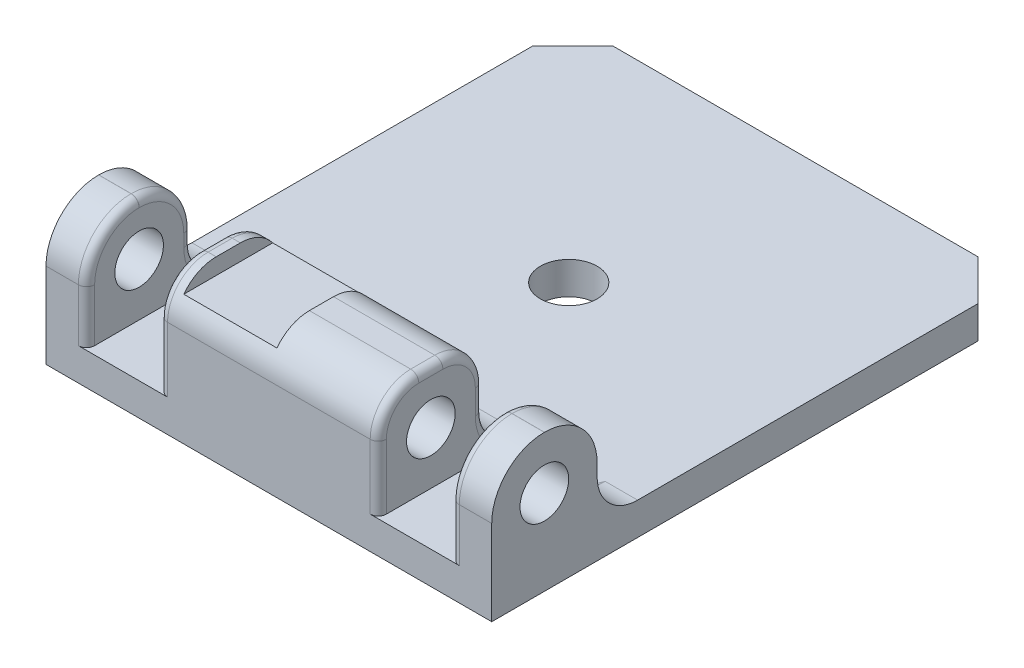
from build123d import *

# Parameters (mm, degrees)
CROQUIS1_W              = 55
CROQUIS1_H              = 65
SALIENTE_EXTRUIR1_DEPTH = 4
CROQUIS5_R              = 3.5
CORTAR_EXTRUIR5_DEPTH   = 72
CHAFL_N1_SIZE           = 5
CROQUIS6_R              = 3
SALIENTE_EXTRUIR2_DEPTH = 55
REDONDEO1_R             = 5
CROQUIS7_W              = 45
CROQUIS7_H              = 13
CROQUIS7_H_2            = 7.525704533
CORTAR_EXTRUIR7_DEPTH   = 20
REDONDEO2_R             = 1
CROQUIS8_W              = 13.499994095
CROQUIS8_H              = 12.974747115
SALIENTE_EXTRUIR3_DEPTH = 13
REDONDEO3_R             = 5
REDONDEO4_R             = 5
REDONDEO5_R             = 1
CROQUIS10_R             = 3
CORTAR_EXTRUIR8_DEPTH   = 26.999988191
CROQUIS11_W             = 11.5
CROQUIS11_H             = 5.447296535
CROQUIS11_H_2           = 2.974747115
CORTAR_EXTRUIR9_DEPTH   = 2


with BuildPart() as part:
    # Croquis1 → Saliente-Extruir1 (new body)
    with BuildSketch(Plane(origin=(0, 0, 0), x_dir=(1, 0, 0), z_dir=(0, 1, 0))):
        Rectangle(CROQUIS1_W, CROQUIS1_H)
    extrude(amount=SALIENTE_EXTRUIR1_DEPTH)

    # Croquis5 → Cortar-Extruir5 (cut)
    with BuildSketch(Plane.XZ):
        with Locations(Location((0, -4.5, 0), (0, 0, 270))):
            Circle(CROQUIS5_R)
    extrude(amount=-CORTAR_EXTRUIR5_DEPTH, mode=Mode.SUBTRACT)

    # Chaflán1
    chafl_n1_edges = [part.edges().sort_by_distance(p)[0] for p in [
        (-27.5, 2, -32.5),
        (27.5, 2, -32.5),
    ]]
    chamfer(chafl_n1_edges, length=CHAFL_N1_SIZE)

    # Croquis6 → Saliente-Extruir2 (add)
    with BuildSketch(Plane.ZY.offset(27.5)):
        with BuildLine():
            Line((32.5, 0), (19.5, 0))
            Line((19.5, 0), (19.5, 10.51))
            ThreePointArc((19.5, 10.51), (21.40087699, 15.09912301), (25.99, 17))
            Line((25.99, 17), (26.01, 17))
            ThreePointArc((26.01, 17), (30.59912301, 15.09912301), (32.5, 10.51))
            Line((32.5, 10.51), (32.5, 0))
        make_face()
        with Locations((26.01, 10.51)):
            Circle(CROQUIS6_R, mode=Mode.SUBTRACT)
    extrude(amount=-SALIENTE_EXTRUIR2_DEPTH)

    # Redondeo1
    redondeo1_edges = [part.edges().sort_by_distance(p)[0] for p in [
        (0, 4, 19.5),
    ]]
    fillet(redondeo1_edges, radius=REDONDEO1_R)

    # Croquis7 → Cortar-Extruir7 (cut)
    with BuildSketch(Plane(origin=(0, 4, 0), x_dir=(1, 0, 0), z_dir=(0, 1, 0))):
        with Locations((0, -26)):
            Rectangle(CROQUIS7_W, CROQUIS7_H)
        with Locations((0, -15.737147734)):
            Rectangle(CROQUIS7_W, CROQUIS7_H_2)
    extrude(amount=CORTAR_EXTRUIR7_DEPTH, mode=Mode.SUBTRACT)

    # Redondeo2
    # the kernel refuses this fillet: 1 mm, written as the material it takes off along each edge
    with BuildSketch(Plane(origin=(22.5, 9, 14.5), x_dir=(0, 0, 1), z_dir=(0, 1, 0))) as redondeo2_piece_1_section:
        with BuildLine():
            CenterArc((5 + REDONDEO2_R, REDONDEO2_R), REDONDEO2_R, 180, 90)
            Line((5 + REDONDEO2_R, 0), (5, 0))
            Line((5, 0), (5, REDONDEO2_R))
        make_face()
    redondeo2_piece_1 = revolve(axis=Axis((22.5, 9, 14.5), (1, 0, 0)), revolution_arc=138.720976341, mode=Mode.PRIVATE)
    redondeo2_piece_1 = split(redondeo2_piece_1, bisect_by=Plane(origin=(22.5, 4, 14.5), z_dir=(0, 1, 0)), keep=Keep.TOP, mode=Mode.PRIVATE)
    add(redondeo2_piece_1, mode=Mode.SUBTRACT)
    with BuildSketch(Plane(origin=(-22.5, 9, 14.5), x_dir=(0, 0, 1), z_dir=(0, 1, 0))) as redondeo2_piece_2_section:
        with BuildLine():
            CenterArc((5 + REDONDEO2_R, -REDONDEO2_R), REDONDEO2_R, 90, 90)
            Line((5 + REDONDEO2_R, 0), (5, 0))
            Line((5, 0), (5, -REDONDEO2_R))
        make_face()
    redondeo2_piece_2 = revolve(axis=Axis((-22.5, 9, 14.5), (1, 0, 0)), revolution_arc=138.720976341, mode=Mode.PRIVATE)
    redondeo2_piece_2 = split(redondeo2_piece_2, bisect_by=Plane(origin=(-22.5, 4, 14.5), z_dir=(0, 1, 0)), keep=Keep.TOP, mode=Mode.PRIVATE)
    add(redondeo2_piece_2, mode=Mode.SUBTRACT)
    with BuildSketch(Plane(origin=(-22.5, 4, 32.5), x_dir=(-1, 0, 0), z_dir=(0, 1, 0))) as redondeo2_piece_3:
        with BuildLine():
            CenterArc((REDONDEO2_R, -REDONDEO2_R), REDONDEO2_R, 90, 90)
            Line((0, -REDONDEO2_R), (0, 0))
            Line((0, 0), (REDONDEO2_R, 0))
        make_face()
    extrude(amount=6.51, mode=Mode.SUBTRACT)
    with BuildSketch(Plane(origin=(-22.5, 17, 25.99), x_dir=(-1, 0, 0), z_dir=(0, 0, 1))) as redondeo2_piece_4:
        with BuildLine():
            CenterArc((REDONDEO2_R, REDONDEO2_R), REDONDEO2_R, 180, 90)
            Line((0, REDONDEO2_R), (0, 0))
            Line((0, 0), (REDONDEO2_R, 0))
        make_face()
    extrude(amount=0.02, mode=Mode.SUBTRACT)
    with BuildSketch(Plane(origin=(-22.5, 10.51, 26.01), x_dir=(0, 0, 1), z_dir=(0, -1, 0))) as redondeo2_piece_5:
        with BuildLine():
            CenterArc((6.49 - REDONDEO2_R, REDONDEO2_R), REDONDEO2_R, 270, 90)
            Line((6.49 - REDONDEO2_R, 0), (6.49, 0))
            Line((6.49, 0), (6.49, REDONDEO2_R))
        make_face()
    revolve(axis=Axis((-22.5, 10.51, 26.01), (-1, 0, 0)), revolution_arc=90, mode=Mode.SUBTRACT)
    with BuildSketch(Plane(origin=(-22.5, 9, 19.5), x_dir=(-1, 0, 0), z_dir=(0, 1, 0))) as redondeo2_piece_6:
        with BuildLine():
            CenterArc((REDONDEO2_R, REDONDEO2_R), REDONDEO2_R, 180, 90)
            Line((0, REDONDEO2_R), (0, 0))
            Line((0, 0), (REDONDEO2_R, 0))
        make_face()
    extrude(amount=1.51, mode=Mode.SUBTRACT)
    with BuildSketch(Plane(origin=(-22.5, 10.51, 25.99), x_dir=(0, 1, 0), z_dir=(0, 0, 1))) as redondeo2_piece_7:
        with BuildLine():
            CenterArc((6.49 - REDONDEO2_R, REDONDEO2_R), REDONDEO2_R, 270, 90)
            Line((6.49 - REDONDEO2_R, 0), (6.49, 0))
            Line((6.49, 0), (6.49, REDONDEO2_R))
        make_face()
    revolve(axis=Axis((-22.5, 10.51, 25.99), (-1, 0, 0)), revolution_arc=90, mode=Mode.SUBTRACT)
    with BuildSketch(Plane(origin=(22.5, 17, 26.01), x_dir=(0, -1, 0), z_dir=(0, 0, -1))) as redondeo2_piece_8:
        with BuildLine():
            CenterArc((REDONDEO2_R, -REDONDEO2_R), REDONDEO2_R, 90, 90)
            Line((0, -REDONDEO2_R), (0, 0))
            Line((0, 0), (REDONDEO2_R, 0))
        make_face()
    extrude(amount=0.02, mode=Mode.SUBTRACT)
    with BuildSketch(Plane(origin=(22.5, 10.51, 26.01), x_dir=(0, 0, 1), z_dir=(0, -1, 0))) as redondeo2_piece_9:
        with BuildLine():
            CenterArc((6.49 - REDONDEO2_R, -REDONDEO2_R), REDONDEO2_R, 0, 90)
            Line((6.49 - REDONDEO2_R, 0), (6.49, 0))
            Line((6.49, 0), (6.49, -REDONDEO2_R))
        make_face()
    revolve(axis=Axis((22.5, 10.51, 26.01), (-1, 0, 0)), revolution_arc=90, mode=Mode.SUBTRACT)
    with BuildSketch(Plane(origin=(22.5, 4, 32.5), x_dir=(1, 0, 0), z_dir=(0, 1, 0))) as redondeo2_piece_10:
        with BuildLine():
            CenterArc((REDONDEO2_R, REDONDEO2_R), REDONDEO2_R, 180, 90)
            Line((0, REDONDEO2_R), (0, 0))
            Line((0, 0), (REDONDEO2_R, 0))
        make_face()
    extrude(amount=6.51, mode=Mode.SUBTRACT)
    with BuildSketch(Plane(origin=(22.5, 10.51, 19.5), x_dir=(0, 0, 1), z_dir=(0, -1, 0))) as redondeo2_piece_11:
        with BuildLine():
            CenterArc((REDONDEO2_R, -REDONDEO2_R), REDONDEO2_R, 90, 90)
            Line((0, -REDONDEO2_R), (0, 0))
            Line((0, 0), (REDONDEO2_R, 0))
        make_face()
    extrude(amount=1.51, mode=Mode.SUBTRACT)
    with BuildSketch(Plane(origin=(22.5, 10.51, 25.99), x_dir=(0, 1, 0), z_dir=(0, 0, 1))) as redondeo2_piece_12:
        with BuildLine():
            CenterArc((6.49 - REDONDEO2_R, -REDONDEO2_R), REDONDEO2_R, 0, 90)
            Line((6.49, -REDONDEO2_R), (6.49, 0))
            Line((6.49, 0), (6.49 - REDONDEO2_R, 0))
        make_face()
    revolve(axis=Axis((22.5, 10.51, 25.99), (-1, 0, 0)), revolution_arc=90, mode=Mode.SUBTRACT)

    # Croquis8 → Saliente-Extruir3 (add)
    with BuildSketch(Plane(origin=(0, 4, 0), x_dir=(1, 0, 0), z_dir=(0, 1, 0))):
        with Locations((-6.749997048, -26.012626443)):
            Rectangle(CROQUIS8_W, CROQUIS8_H)
        with Locations((6.749997048, -26.012626443)):
            Rectangle(CROQUIS8_W, CROQUIS8_H)
    extrude(amount=SALIENTE_EXTRUIR3_DEPTH)

    # Redondeo3
    redondeo3_edges = [part.edges().sort_by_distance(p)[0] for p in [
        (0, 17, 19.525252885),
        (0, 17, 32.5),
    ]]
    fillet(redondeo3_edges, radius=REDONDEO3_R)

    # Redondeo4
    redondeo4_edges = [part.edges().sort_by_distance(p)[0] for p in [
        (0, 4, 19.525252885),
    ]]
    fillet(redondeo4_edges, radius=REDONDEO4_R)

    # Redondeo5
    # the kernel refuses this fillet: 1 mm, written as the material it takes off along each edge
    with BuildSketch(Plane(origin=(-13.499994095, 9, 19.525252885), x_dir=(0, 0, 1), z_dir=(0, 1, 0))) as redondeo5_piece_1:
        with BuildLine():
            CenterArc((REDONDEO5_R, REDONDEO5_R), REDONDEO5_R, 180, 90)
            Line((0, REDONDEO5_R), (0, 0))
            Line((0, 0), (REDONDEO5_R, 0))
        make_face()
    extrude(amount=3, mode=Mode.SUBTRACT)
    with BuildSketch(Plane(origin=(13.499994095, 9, 19.525252885), x_dir=(0, 0, 1), z_dir=(0, 1, 0))) as redondeo5_piece_2:
        with BuildLine():
            CenterArc((REDONDEO5_R, -REDONDEO5_R), REDONDEO5_R, 90, 90)
            Line((0, -REDONDEO5_R), (0, 0))
            Line((0, 0), (REDONDEO5_R, 0))
        make_face()
    extrude(amount=3, mode=Mode.SUBTRACT)
    with BuildSketch(Plane(origin=(13.499994095, 17, 27.5), x_dir=(0, -1, 0), z_dir=(0, 0, -1)), Plane(origin=(-13.499994095, 17, 24.525252885), x_dir=(0, -1, 0), z_dir=(0, 0, 1))) as redondeo5_piece_3:
        with BuildLine():
            CenterArc((REDONDEO5_R, REDONDEO5_R), REDONDEO5_R, 180, 90)
            Line((0, REDONDEO5_R), (0, 0))
            Line((0, 0), (REDONDEO5_R, 0))
        make_face()
    extrude(amount=2.974747115, mode=Mode.SUBTRACT)
    with BuildSketch(Plane(origin=(13.499994095, 4, 32.5), x_dir=(0, 0, -1), z_dir=(0, 1, 0))) as redondeo5_piece_4:
        with BuildLine():
            CenterArc((REDONDEO5_R, REDONDEO5_R), REDONDEO5_R, 180, 90)
            Line((0, REDONDEO5_R), (0, 0))
            Line((0, 0), (REDONDEO5_R, 0))
        make_face()
    extrude(amount=8, mode=Mode.SUBTRACT)
    with BuildSketch(Plane(origin=(13.499994095, 12, 27.5), x_dir=(0, 0, 1), z_dir=(0, -1, 0))) as redondeo5_piece_5:
        with BuildLine():
            CenterArc((5 - REDONDEO5_R, REDONDEO5_R), REDONDEO5_R, 270, 90)
            Line((5, REDONDEO5_R), (5, 0))
            Line((5, 0), (5 - REDONDEO5_R, 0))
        make_face()
    revolve(axis=Axis((13.499994095, 12, 27.5), (-1, 0, 0)), revolution_arc=90, mode=Mode.SUBTRACT)
    with BuildSketch(Plane(origin=(13.499994095, 12, 24.525252885), x_dir=(0, 0, -1), z_dir=(0, -1, 0))) as redondeo5_piece_6:
        with BuildLine():
            CenterArc((5 - REDONDEO5_R, -REDONDEO5_R), REDONDEO5_R, 0, 90)
            Line((5, -REDONDEO5_R), (5, 0))
            Line((5, 0), (5 - REDONDEO5_R, 0))
        make_face()
    revolve(axis=Axis((13.499994095, 12, 24.525252885), (1, 0, 0)), revolution_arc=90, mode=Mode.SUBTRACT)
    with BuildSketch(Plane(origin=(-13.499994095, 4, 32.5), x_dir=(0, 0, -1), z_dir=(0, 1, 0))) as redondeo5_piece_7:
        with BuildLine():
            CenterArc((REDONDEO5_R, -REDONDEO5_R), REDONDEO5_R, 90, 90)
            Line((0, -REDONDEO5_R), (0, 0))
            Line((0, 0), (REDONDEO5_R, 0))
        make_face()
    extrude(amount=8, mode=Mode.SUBTRACT)
    with BuildSketch(Plane(origin=(-13.499994095, 12, 27.5), x_dir=(0, 0, 1), z_dir=(0, -1, 0))) as redondeo5_piece_8:
        with BuildLine():
            CenterArc((5 - REDONDEO5_R, -REDONDEO5_R), REDONDEO5_R, 0, 90)
            Line((5, -REDONDEO5_R), (5, 0))
            Line((5, 0), (5 - REDONDEO5_R, 0))
        make_face()
    revolve(axis=Axis((-13.499994095, 12, 27.5), (-1, 0, 0)), revolution_arc=90, mode=Mode.SUBTRACT)
    with BuildSketch(Plane(origin=(-13.499994095, 12, 24.525252885), x_dir=(0, 0, -1), z_dir=(0, -1, 0))) as redondeo5_piece_9:
        with BuildLine():
            CenterArc((5 - REDONDEO5_R, REDONDEO5_R), REDONDEO5_R, 270, 90)
            Line((5, REDONDEO5_R), (5, 0))
            Line((5, 0), (5 - REDONDEO5_R, 0))
        make_face()
    revolve(axis=Axis((-13.499994095, 12, 24.525252885), (1, 0, 0)), revolution_arc=90, mode=Mode.SUBTRACT)
    with BuildSketch(Plane(origin=(13.499994095, 9, 14.525252885), x_dir=(0, -0.6597265812708417, -0.7515057138603056), z_dir=(0, 0.7515057138603056, -0.6597265812708417))) as redondeo5_piece_10_section:
        with BuildLine():
            CenterArc((5 + REDONDEO5_R, REDONDEO5_R), REDONDEO5_R, 180, 90)
            Line((5 + REDONDEO5_R, 0), (5, 0))
            Line((5, 0), (5, REDONDEO5_R))
        make_face()
    redondeo5_piece_10 = revolve(axis=Axis((13.499994095, 9, 14.525252885), (-1, 0, 0)), revolution_arc=138.720976341, mode=Mode.PRIVATE)
    redondeo5_piece_10 = split(redondeo5_piece_10, bisect_by=Plane(origin=(13.499994095, 4, 14.525252885), z_dir=(0, 1, 0)), keep=Keep.TOP, mode=Mode.PRIVATE)
    add(redondeo5_piece_10, mode=Mode.SUBTRACT)
    with BuildSketch(Plane(origin=(-13.499994095, 9, 14.525252885), x_dir=(0, -0.6597265812708417, -0.7515057138603056), z_dir=(0, 0.7515057138603056, -0.6597265812708417))) as redondeo5_piece_11_section:
        with BuildLine():
            CenterArc((5 + REDONDEO5_R, -REDONDEO5_R), REDONDEO5_R, 90, 90)
            Line((5, -REDONDEO5_R), (5, 0))
            Line((5, 0), (5 + REDONDEO5_R, 0))
        make_face()
    redondeo5_piece_11 = revolve(axis=Axis((-13.499994095, 9, 14.525252885), (-1, 0, 0)), revolution_arc=138.720976341, mode=Mode.PRIVATE)
    redondeo5_piece_11 = split(redondeo5_piece_11, bisect_by=Plane(origin=(-13.499994095, 4, 14.525252885), z_dir=(0, 1, 0)), keep=Keep.TOP, mode=Mode.PRIVATE)
    add(redondeo5_piece_11, mode=Mode.SUBTRACT)

    # Croquis10 → Cortar-Extruir8 (cut)
    with BuildSketch(Plane.ZY.offset(13.499994095)):
        with Locations((26.01, 10.51)):
            Circle(CROQUIS10_R)
    extrude(amount=-CORTAR_EXTRUIR8_DEPTH, mode=Mode.SUBTRACT)

    # Croquis11 → Cortar-Extruir9 (cut)
    with BuildSketch(Plane(origin=(0, 17, 0), x_dir=(1, 0, 0), z_dir=(0, 1, 0))):
        with Locations((-5.749994095, -21.801604618)):
            Rectangle(CROQUIS11_W, CROQUIS11_H)
        with Locations((-5.749994095, -26.012626443)):
            Rectangle(CROQUIS11_W, CROQUIS11_H_2)
        with Locations((-5.749994095, -30.223648267)):
            Rectangle(CROQUIS11_W, CROQUIS11_H)
    extrude(amount=-CORTAR_EXTRUIR9_DEPTH, mode=Mode.SUBTRACT)


solid = part.part
